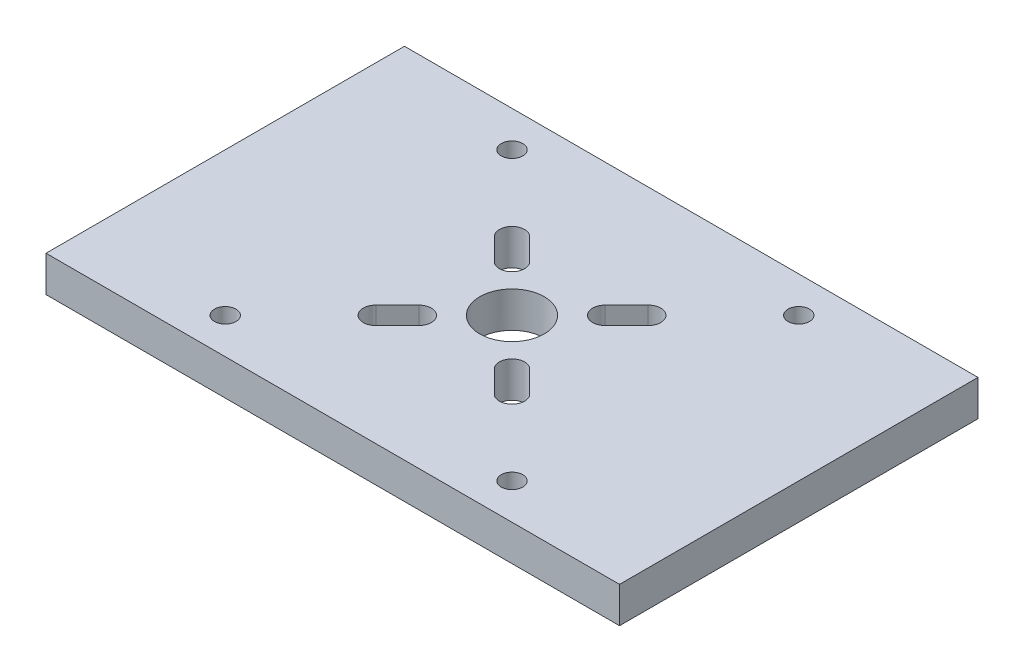
from build123d import *

# Parameters (mm, degrees)
SKETCH1_W          = 160
SKETCH1_H          = 100
BASE_DEPTH         = 10
SKETCH2_R          = 9
ACTUATOR_CUT_DEPTH = 40
CUT_EXTRUDE1_REACH = 96.868
CUT_EXTRUDE2_REACH = 96.868
SKETCH5_R          = 3
SKETCH6_R          = 4
CUT_EXTRUDE3_DEPTH = 5


with BuildPart() as part:
    # Sketch1 → base (new body)
    with BuildSketch(Plane(origin=(0, 0, 0), x_dir=(1, 0, 0), z_dir=(0, 1, 0))):
        Rectangle(SKETCH1_W, SKETCH1_H)
    extrude(amount=BASE_DEPTH)

    # Sketch2 → actuator cut (cut)
    with BuildSketch(Plane(origin=(0, 10, 0), x_dir=(1, 0, 0), z_dir=(0, 1, 0))):
        Circle(SKETCH2_R)
    extrude(amount=-ACTUATOR_CUT_DEPTH, mode=Mode.SUBTRACT)

    # Sketch3 → Cut-Extrude1 (cut, up to next)
    with BuildSketch(Plane(origin=(0, 10, 0), x_dir=(1, 0, 0), z_dir=(0, 1, 0)), mode=Mode.PRIVATE) as cut_extrude1_sk1:
        with BuildLine():
            Line((-21.474873734, -16.525126266), (-15.474873734, -10.525126266))
            ThreePointArc((-15.474873734, -10.525126266), (-10.525126266, -10.525126266), (-10.525126266, -15.474873734))
            Line((-10.525126266, -15.474873734), (-16.525126266, -21.474873734))
            ThreePointArc((-16.525126266, -21.474873734), (-21.474873734, -21.474873734), (-21.474873734, -16.525126266))
        make_face()
    cut_extrude1_tool1 = extrude(cut_extrude1_sk1.sketch, amount=-CUT_EXTRUDE1_REACH, mode=Mode.PRIVATE) & part.part
    # Sketch3 → Cut-Extrude1 (cut, up to next)
    with BuildSketch(Plane(origin=(0, 10, 0), x_dir=(1, 0, 0), z_dir=(0, 1, 0)), mode=Mode.PRIVATE) as cut_extrude1_sk2:
        with BuildLine():
            Line((21.474873734, -16.525126266), (15.474873734, -10.525126266))
            ThreePointArc((15.474873734, -10.525126266), (10.525126266, -10.525126266), (10.525126266, -15.474873734))
            Line((10.525126266, -15.474873734), (16.525126266, -21.474873734))
            ThreePointArc((16.525126266, -21.474873734), (21.474873734, -21.474873734), (21.474873734, -16.525126266))
        make_face()
    cut_extrude1_tool2 = extrude(cut_extrude1_sk2.sketch, amount=-CUT_EXTRUDE1_REACH, mode=Mode.PRIVATE) & part.part
    # Sketch3 → Cut-Extrude1 (cut, up to next)
    with BuildSketch(Plane(origin=(0, 10, 0), x_dir=(1, 0, 0), z_dir=(0, 1, 0)), mode=Mode.PRIVATE) as cut_extrude1_sk3:
        with BuildLine():
            Line((21.474873734, 16.525126266), (15.474873734, 10.525126266))
            ThreePointArc((15.474873734, 10.525126266), (10.525126266, 10.525126266), (10.525126266, 15.474873734))
            Line((10.525126266, 15.474873734), (16.525126266, 21.474873734))
            ThreePointArc((16.525126266, 21.474873734), (21.474873734, 21.474873734), (21.474873734, 16.525126266))
        make_face()
    cut_extrude1_tool3 = extrude(cut_extrude1_sk3.sketch, amount=-CUT_EXTRUDE1_REACH, mode=Mode.PRIVATE) & part.part
    # Sketch3 → Cut-Extrude1 (cut, up to next)
    with BuildSketch(Plane(origin=(0, 10, 0), x_dir=(1, 0, 0), z_dir=(0, 1, 0)), mode=Mode.PRIVATE) as cut_extrude1_sk4:
        with BuildLine():
            Line((-21.474873734, 16.525126266), (-15.474873734, 10.525126266))
            ThreePointArc((-15.474873734, 10.525126266), (-10.525126266, 10.525126266), (-10.525126266, 15.474873734))
            Line((-10.525126266, 15.474873734), (-16.525126266, 21.474873734))
            ThreePointArc((-16.525126266, 21.474873734), (-21.474873734, 21.474873734), (-21.474873734, 16.525126266))
        make_face()
    cut_extrude1_tool4 = extrude(cut_extrude1_sk4.sketch, amount=-CUT_EXTRUDE1_REACH, mode=Mode.PRIVATE) & part.part
    add(cut_extrude1_tool1.solids().sort_by_distance((-16, 10, 16))[0], mode=Mode.SUBTRACT)
    add(cut_extrude1_tool2.solids().sort_by_distance((16, 10, 16))[0], mode=Mode.SUBTRACT)
    add(cut_extrude1_tool3.solids().sort_by_distance((16, 10, -16))[0], mode=Mode.SUBTRACT)
    add(cut_extrude1_tool4.solids().sort_by_distance((-16, 10, -16))[0], mode=Mode.SUBTRACT)

    # Sketch5 → Cut-Extrude2 (cut, up to next)
    with BuildSketch(Plane(origin=(0, 10, 0), x_dir=(1, 0, 0), z_dir=(0, 1, 0)), mode=Mode.PRIVATE) as cut_extrude2_sk1:
        with Locations((-40, -40)):
            Circle(SKETCH5_R)
    cut_extrude2_tool1 = extrude(cut_extrude2_sk1.sketch, amount=-CUT_EXTRUDE2_REACH, mode=Mode.PRIVATE) & part.part
    # Sketch5 → Cut-Extrude2 (cut, up to next)
    with BuildSketch(Plane(origin=(0, 10, 0), x_dir=(1, 0, 0), z_dir=(0, 1, 0)), mode=Mode.PRIVATE) as cut_extrude2_sk2:
        with Locations((-40, 40)):
            Circle(SKETCH5_R)
    cut_extrude2_tool2 = extrude(cut_extrude2_sk2.sketch, amount=-CUT_EXTRUDE2_REACH, mode=Mode.PRIVATE) & part.part
    # Sketch5 → Cut-Extrude2 (cut, up to next)
    with BuildSketch(Plane(origin=(0, 10, 0), x_dir=(1, 0, 0), z_dir=(0, 1, 0)), mode=Mode.PRIVATE) as cut_extrude2_sk3:
        with Locations((40, -40)):
            Circle(SKETCH5_R)
    cut_extrude2_tool3 = extrude(cut_extrude2_sk3.sketch, amount=-CUT_EXTRUDE2_REACH, mode=Mode.PRIVATE) & part.part
    # Sketch5 → Cut-Extrude2 (cut, up to next)
    with BuildSketch(Plane(origin=(0, 10, 0), x_dir=(1, 0, 0), z_dir=(0, 1, 0)), mode=Mode.PRIVATE) as cut_extrude2_sk4:
        with Locations((40, 40)):
            Circle(SKETCH5_R)
    cut_extrude2_tool4 = extrude(cut_extrude2_sk4.sketch, amount=-CUT_EXTRUDE2_REACH, mode=Mode.PRIVATE) & part.part
    add(cut_extrude2_tool1.solids().sort_by_distance((-40, 10, 40))[0], mode=Mode.SUBTRACT)
    add(cut_extrude2_tool2.solids().sort_by_distance((-40, 10, -40))[0], mode=Mode.SUBTRACT)
    add(cut_extrude2_tool3.solids().sort_by_distance((40, 10, 40))[0], mode=Mode.SUBTRACT)
    add(cut_extrude2_tool4.solids().sort_by_distance((40, 10, -40))[0], mode=Mode.SUBTRACT)

    # Sketch6 → Cut-Extrude3 (cut)
    with BuildSketch(Plane.XZ):
        with Locations((-40, 40)):
            Circle(SKETCH6_R)
        with Locations((40, 40)):
            Circle(SKETCH6_R)
        with Locations((40, -40)):
            Circle(SKETCH6_R)
        with Locations((-40, -40)):
            Circle(SKETCH6_R)
    extrude(amount=-CUT_EXTRUDE3_DEPTH, mode=Mode.SUBTRACT)


solid = part.part
